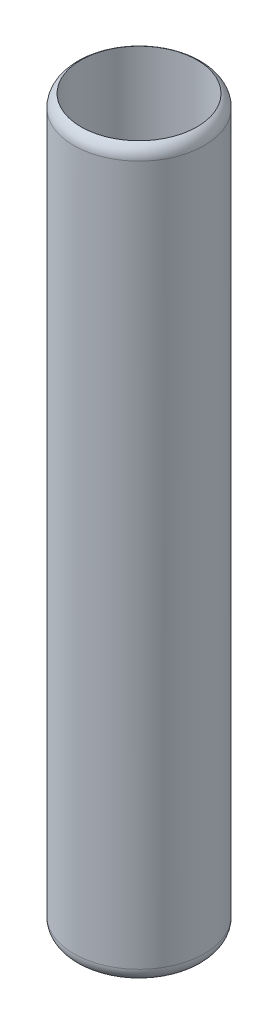
from build123d import *

# Parameters (mm, degrees)
SKETCH1_R           = 4.5
BOSS_EXTRUDE1_DEPTH = 50
SKETCH2_R           = 4
CUT_EXTRUDE1_DEPTH  = 50
FILLET2_R           = 1


with BuildPart() as part:
    # Sketch1 → Boss-Extrude1 (new body)
    with BuildSketch(Plane(origin=(0, 0, 0), x_dir=(1, 0, 0), z_dir=(0, 1, 0))):
        with Locations(Location((0, 0, 0), (0, 0, 270))):
            Circle(SKETCH1_R)
    extrude(amount=BOSS_EXTRUDE1_DEPTH)

    # Sketch2 → Cut-Extrude1 (cut)
    with BuildSketch(Plane(origin=(0, 50, 0), x_dir=(1, 0, 0), z_dir=(0, 1, 0))):
        with Locations(Location((0, 0, 0), (0, 0, 270))):
            Circle(SKETCH2_R)
    extrude(amount=-CUT_EXTRUDE1_DEPTH, mode=Mode.SUBTRACT)

    # Fillet2
    # the kernel refuses this fillet: 1 mm, written as the material it takes off along each edge
    with BuildSketch(Plane(origin=(0, 0, 0), x_dir=(0, 0, 1), z_dir=(-1, 0, 0))) as fillet2_piece_1:
        with BuildLine():
            CenterArc((3.5, 0.866025404), FILLET2_R, 300, 60)
            Line((4, 0), (4.01, -0.017320508))
            ThreePointArc((4.01, -0.017320508), (4.25, -0.02), (4.5, -0.02))
            Line((4.5, -0.02), (4.52, 0))
            Line((4.52, 0), (4.52, 0.866025404))
            Line((4.52, 0.866025404), (4.5, 0.866025404))
        make_face()
    revolve(axis=Axis((0, 0, 0), (0, 1, 0)), mode=Mode.SUBTRACT)
    with BuildSketch(Plane(origin=(0, 50, 0), x_dir=(0, 0, 1), z_dir=(-1, 0, 0))) as fillet2_piece_2:
        with BuildLine():
            CenterArc((3.5, -0.866025404), FILLET2_R, 0, 60)
            Line((4, 0), (4.01, 0.017320508))
            ThreePointArc((4.01, 0.017320508), (4.25, 0.02), (4.5, 0.02))
            Line((4.5, 0.02), (4.52, 0))
            Line((4.52, 0), (4.52, -0.866025404))
            Line((4.52, -0.866025404), (4.5, -0.866025404))
        make_face()
    revolve(axis=Axis((0, 50, 0), (0, 1, 0)), mode=Mode.SUBTRACT)


solid = part.part
